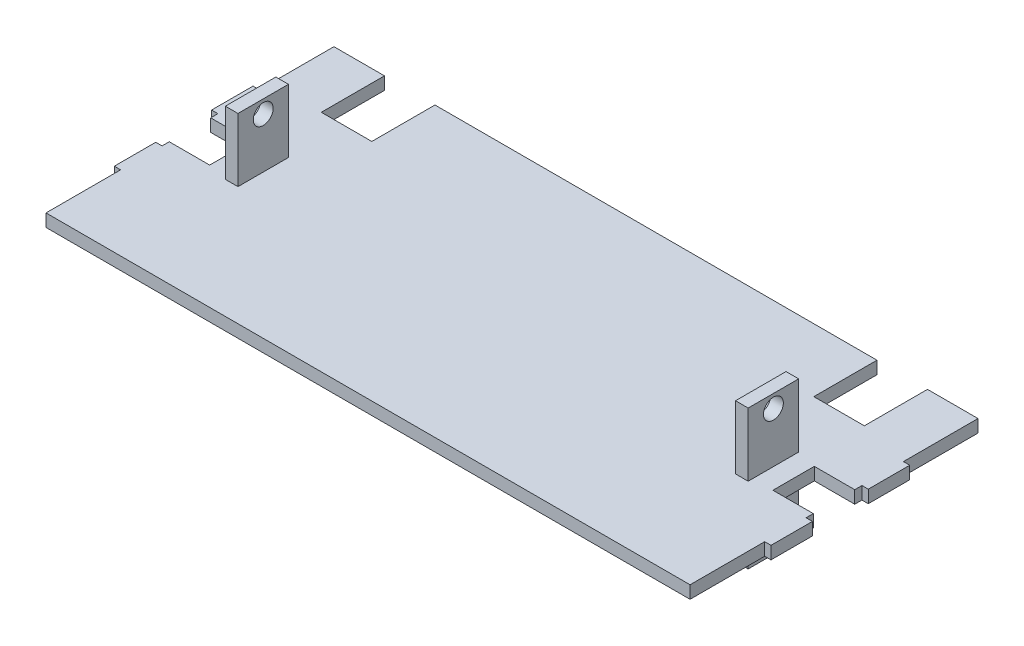
from build123d import *

# Parameters (mm, degrees)
BOSS_EXTRUDE1_DEPTH     = 3.175
SKETCH2_W               = 6.35
SKETCH2_H               = 25.4
BOSS_EXTRUDE2_DEPTH     = 35.052
CUT_EXTRUDE1_DEPTH      = 308.258672504
CUT_EXTRUDE1_DEPTH_BACK = 308.258672504
SKETCH3_R               = 5.0038


with BuildPart() as part:
    # Sketch1 → Boss-Extrude1 (new, symmetric)
    with BuildSketch(Plane(origin=(0, 0, 0), x_dir=(1, 0, 0), z_dir=(0, 1, 0))):
        Polygon((161.925, -72.39), (-161.925, -72.39), (-161.925, -34.874677354), (-165.1, -34.874677354), (-165.1, -14.046677354), (-161.925, -14.046677354), (-161.925, -10.414), (-141.605, -10.414), (-141.605, 10.414), (-161.925, 10.414), (-161.925, 14.046677354), (-165.1, 14.046677354), (-165.1, 34.874677354), (-161.925, 34.874677354), (-161.925, 72.39), (-136.525, 72.39), (-136.525, 40.64), (-111.125, 40.64), (-111.125, 72.39), (111.125, 72.39), (111.125, 40.64), (136.525, 40.64), (136.525, 72.39), (161.925, 72.39), (161.925, 34.874677354), (165.1, 34.874677354), (165.1, 14.046677354), (161.925, 14.046677354), (161.925, 10.414), (141.605, 10.414), (141.605, -10.414), (161.925, -10.414), (161.925, -14.046677354), (165.1, -14.046677354), (165.1, -34.874677354), (161.925, -34.874677354), align=None)
    extrude(amount=BOSS_EXTRUDE1_DEPTH, both=True)

    # Sketch2 → Boss-Extrude2 (add, symmetric)
    with BuildSketch(Plane(origin=(0, 0, 0), x_dir=(1, 0, 0), z_dir=(0, 1, 0))):
        with Locations((128.27, 0)):
            Rectangle(SKETCH2_W, SKETCH2_H)
        with Locations((-128.27, 0)):
            Rectangle(SKETCH2_W, SKETCH2_H)
    extrude(amount=BOSS_EXTRUDE2_DEPTH, both=True)

    # Sketch3 → Cut-Extrude1 (cut, two sides: drawn at the far end of the back side and taken through both)
    with BuildSketch(Plane.ZY.offset(131.445).offset(-CUT_EXTRUDE1_DEPTH_BACK)):
        with Locations((0, 28.440626924)):
            Circle(SKETCH3_R)
        with Locations((0, -28.440626924)):
            Circle(SKETCH3_R)
    extrude(amount=CUT_EXTRUDE1_DEPTH + CUT_EXTRUDE1_DEPTH_BACK, mode=Mode.SUBTRACT)


solid = part.part
